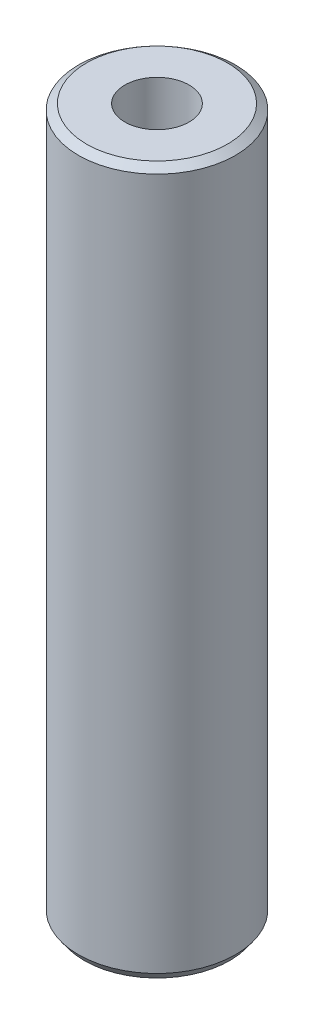
from build123d import *
from OCP.BRepFilletAPI import BRepFilletAPI_MakeChamfer

# Parameters (mm, degrees)
SKETCH1_R           = 12.5
BOSS_EXTRUDE1_DEPTH = 112.504714228
SKETCH2_R           = 5.119054605
CUT_EXTRUDE1_DEPTH  = 114.885076826
CHAMFER1_SIZE       = 0.91369143
CHAMFER1_SIZE2      = 1.27346059


with BuildPart() as part:
    # Sketch1 → Boss-Extrude1 (new body)
    with BuildSketch(Plane(origin=(0, 0, 0), x_dir=(1, 0, 0), z_dir=(0, 1, 0))):
        Circle(SKETCH1_R)
    extrude(amount=BOSS_EXTRUDE1_DEPTH)

    # Sketch2 → Cut-Extrude1 (cut, through all)
    with BuildSketch(Plane(origin=(0, 0, 0), x_dir=(1, 0, 0), z_dir=(0, 1, 0))):
        Circle(SKETCH2_R)
    extrude(amount=CUT_EXTRUDE1_DEPTH, mode=Mode.SUBTRACT)

    # Chamfer1: one chamfer whose edges measure the first distance from different faces: ONE call of the kernel's chamfer builder (chamfer() names one face for all edges)
    chamfer1_edges_1 = [part.edges().sort_by_distance(p)[0] for p in [
        (-12.5, 112.504714228, 0),
    ]]
    chamfer1_side_1 = [part.faces().sort_by_distance(p)[0] for p in [
        (-12.5, 56.252357114, 0),
    ]]
    chamfer1_edges_2 = [part.edges().sort_by_distance(p)[0] for p in [
        (-12.5, 0, 0),
    ]]
    chamfer1_side_2 = [part.faces().sort_by_distance(p)[0] for p in [
        (-12.146446609, 0, 0),
    ]]
    chamfer1 = BRepFilletAPI_MakeChamfer(part.part.solid().wrapped)
    for e in chamfer1_edges_1:
        chamfer1.Add(CHAMFER1_SIZE, CHAMFER1_SIZE2, e.wrapped, chamfer1_side_1[0].wrapped)  # the first distance lies on this face
    for e in chamfer1_edges_2:
        chamfer1.Add(CHAMFER1_SIZE, CHAMFER1_SIZE2, e.wrapped, chamfer1_side_2[0].wrapped)  # the first distance lies on this face
    add(Compound.cast(chamfer1.Shape()), mode=Mode.REPLACE)


solid = part.part
